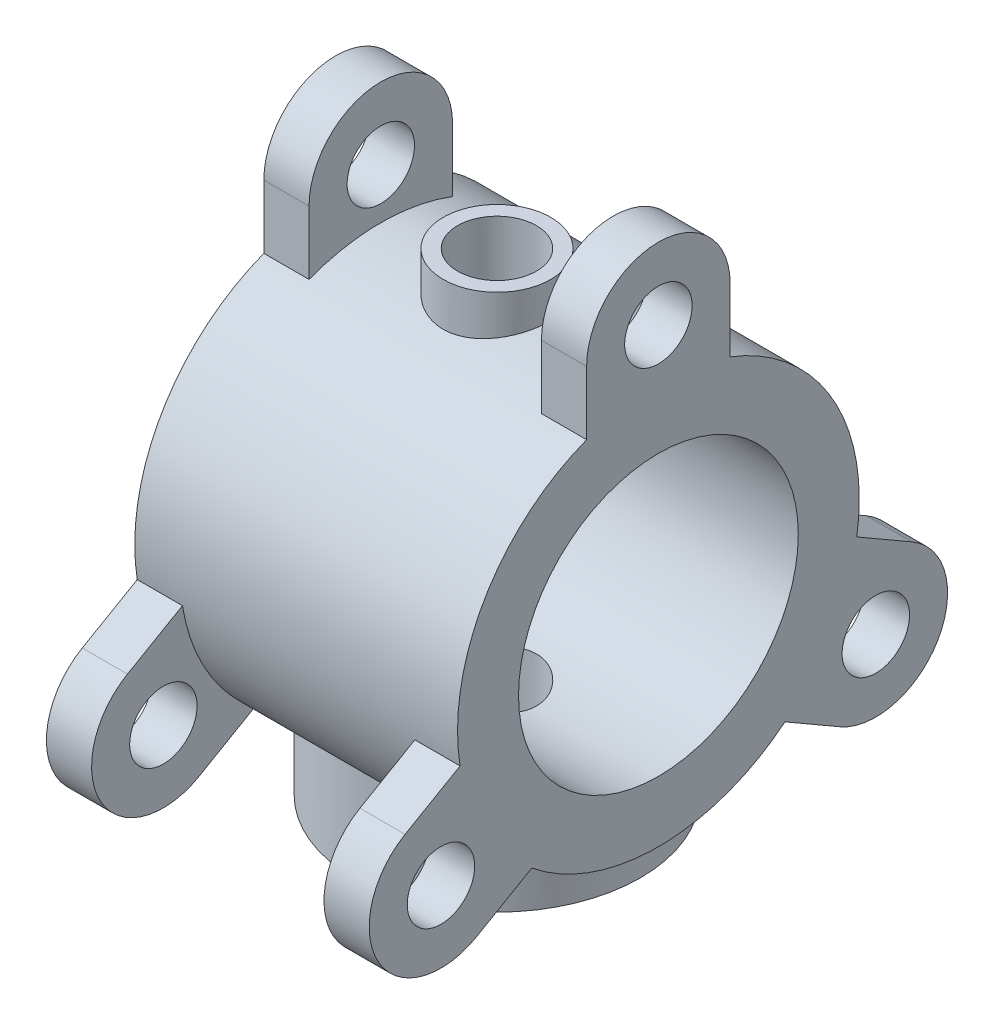
from build123d import *
from build123d.topology import SkipClean

# Parameters (mm, degrees)
SKETCH1_R                = 28
SKETCH1_R_2              = 19.5
BOSS_EXTRUDE1_DEPTH      = 22.5
BOSS_EXTRUDE2_REACH      = 72.79
BOSS_EXTRUDE2_END_RADIUS = 28
SKETCH2_R                = 7.5
BOSS_EXTRUDE3_REACH      = 77.142
BOSS_EXTRUDE3_END_RADIUS = 28
SKETCH3_R                = 20
HOLE1_D                  = 11
HOLE1_CBORE_D            = 20
HOLE1_CBORE_DEPTH        = 5
BOSS_EXTRUDE4_DEPTH      = 6.3
CIRPATTERN2_COUNT        = 3
MIRROR3_COPY_1_DEPTH     = 6.3
MIRROR3_COPY_2_DEPTH     = 6.3
HOLE4_D                  = 9.4
HOLE4_DEPTH              = 6.3
HOLE5_D                  = 9.4
HOLE5_DEPTH              = 6.3


with BuildPart() as part:
    # Sketch1 → Boss-Extrude1 (new, symmetric)
    with BuildSketch(Plane(origin=(0, 0, 0), x_dir=(0, 0, -1), z_dir=(1, 0, 0))):
        with Locations(Location((0, 0, 0), (0, 0, 180))):
            Circle(SKETCH1_R)
        with Locations(Location((0, 0, 0), (0, 0, 180))):
            Circle(SKETCH1_R_2, mode=Mode.SUBTRACT)
    extrude(amount=BOSS_EXTRUDE1_DEPTH, both=True)

    # Boss-Extrude2: up to this cylinder (the profile starts outside it)
    boss_extrude2_end = Plane(origin=(0, 0, 0), z_dir=(-1, 0, 0)) * Cylinder(BOSS_EXTRUDE2_END_RADIUS, 202.58, mode=Mode.PRIVATE)
    # Sketch2 → Boss-Extrude2 (add, up to the surface)
    with BuildSketch(Plane(origin=(0, 33, 0), x_dir=(1, 0, 0), z_dir=(0, 1, 0)), mode=Mode.PRIVATE) as boss_extrude2_sk1:
        with Locations(Location((0, 0, 0), (0, 0, 270))):
            Circle(SKETCH2_R)
    boss_extrude2_tool1 = extrude(boss_extrude2_sk1.sketch, amount=-BOSS_EXTRUDE2_REACH, mode=Mode.PRIVATE) - boss_extrude2_end
    add(boss_extrude2_tool1.solids().sort_by_distance((0, 33, 0))[0])

    # Boss-Extrude3: up to this cylinder (the profile starts outside it)
    boss_extrude3_end = Plane(origin=(0, 0, 0), z_dir=(-1, 0, 0)) * Cylinder(BOSS_EXTRUDE3_END_RADIUS, 211.284, mode=Mode.PRIVATE)
    # Sketch3 → Boss-Extrude3 (add, up to the surface)
    with BuildSketch(Plane(origin=(0, -33, 0), x_dir=(1, 0, 0), z_dir=(0, 1, 0)), mode=Mode.PRIVATE) as boss_extrude3_sk1:
        with Locations(Location((0, 0, 0), (0, 0, 90))):
            Circle(SKETCH3_R)
    boss_extrude3_tool1 = extrude(boss_extrude3_sk1.sketch, amount=BOSS_EXTRUDE3_REACH, mode=Mode.PRIVATE) - boss_extrude3_end
    add(boss_extrude3_tool1.solids().sort_by_distance((0, -33, 0))[0])

    # Hole1 (through all)
    with Locations(Plane(origin=(0, -33, 0), x_dir=(-1, 0, 0), z_dir=(0, -1, 0))):
        with Locations((0, 0)):
            CounterBoreHole(HOLE1_D / 2, HOLE1_CBORE_D / 2, HOLE1_CBORE_DEPTH)

    # Sketch6 → Boss-Extrude4 (add)
    with BuildSketch(Plane.ZY.offset(22.5)):
        with BuildLine():
            Line((-10.004005993, 35), (-10.004005993, 16.738275422))
            ThreePointArc((-10.004005993, 16.738275422), (0, 19.5), (10.004005993, 16.738275422))
            Line((10.004005993, 16.738275422), (10.004005993, 35))
            ThreePointArc((10.004005993, 35), (0, 45.004005993), (-10.004005993, 35))
        make_face()
    boss_extrude4 = extrude(amount=-BOSS_EXTRUDE4_DEPTH)

    # CirPattern2: Boss-Extrude4 ×3 about axis
    with SkipClean():  # the faces are left unmerged after this step: merging them gives an invalid solid
        cirpattern2_axis = Axis((0, 0, 0), (1, 0, 0))
        for i in range(1, CIRPATTERN2_COUNT):
            add(boss_extrude4.rotate(cirpattern2_axis, i * 360 / CIRPATTERN2_COUNT))

    # Mirror3: Boss-Extrude4 across plane
    add(boss_extrude4.mirror(Plane(origin=(0, 0, 0), x_dir=(0, 0, 1), z_dir=(1, 0, 0))))

    # Mirror3 copy 1 sketch → Mirror3 copy 1 (add)
    with SkipClean():  # the faces are left unmerged after this step: merging them gives an invalid solid
        with BuildSketch(Plane(origin=(22.5, 0, 0), x_dir=(0, -0.8660254037844387, -0.4999999999999998), z_dir=(1, 0, 0))):
            with BuildLine():
                Line((-10.004005993, -35), (-10.004005993, -16.738275422))
                ThreePointArc((-10.004005993, -16.738275422), (0, -19.5), (10.004005993, -16.738275422))
                Line((10.004005993, -16.738275422), (10.004005993, -35))
                ThreePointArc((10.004005993, -35), (0, -45.004005993), (-10.004005993, -35))
            make_face()
        extrude(amount=-MIRROR3_COPY_1_DEPTH)

    # Mirror3 copy 2 sketch → Mirror3 copy 2 (add)
    with SkipClean():  # the faces are left unmerged after this step: merging them gives an invalid solid
        with BuildSketch(Plane(origin=(22.5, 0, 0), x_dir=(0, 0.8660254037844384, -0.5000000000000004), z_dir=(1, 0, 0))):
            with BuildLine():
                Line((-10.004005993, -35), (-10.004005993, -16.738275422))
                ThreePointArc((-10.004005993, -16.738275422), (0, -19.5), (10.004005993, -16.738275422))
                Line((10.004005993, -16.738275422), (10.004005993, -35))
                ThreePointArc((10.004005993, -35), (0, -45.004005993), (-10.004005993, -35))
            make_face()
        extrude(amount=-MIRROR3_COPY_2_DEPTH)
    add(part.part.scale(1), mode=Mode.REPLACE)  # the faces are merged on a copy

    # Hole4
    with Locations(Plane.ZY.offset(22.5)):
        with Locations((30.310889132, -17.5), (0, 35), (-30.310889132, -17.5)):
            Hole(HOLE4_D / 2, depth=HOLE4_DEPTH)

    # Hole5
    with Locations(Plane(origin=(22.5, 0, 0), x_dir=(0, 0, -1), z_dir=(1, 0, 0))):
        with Locations((0, 35), (30.310889132, -17.5), (-30.310889132, -17.5)):
            Hole(HOLE5_D / 2, depth=HOLE5_DEPTH)


solid = part.part
